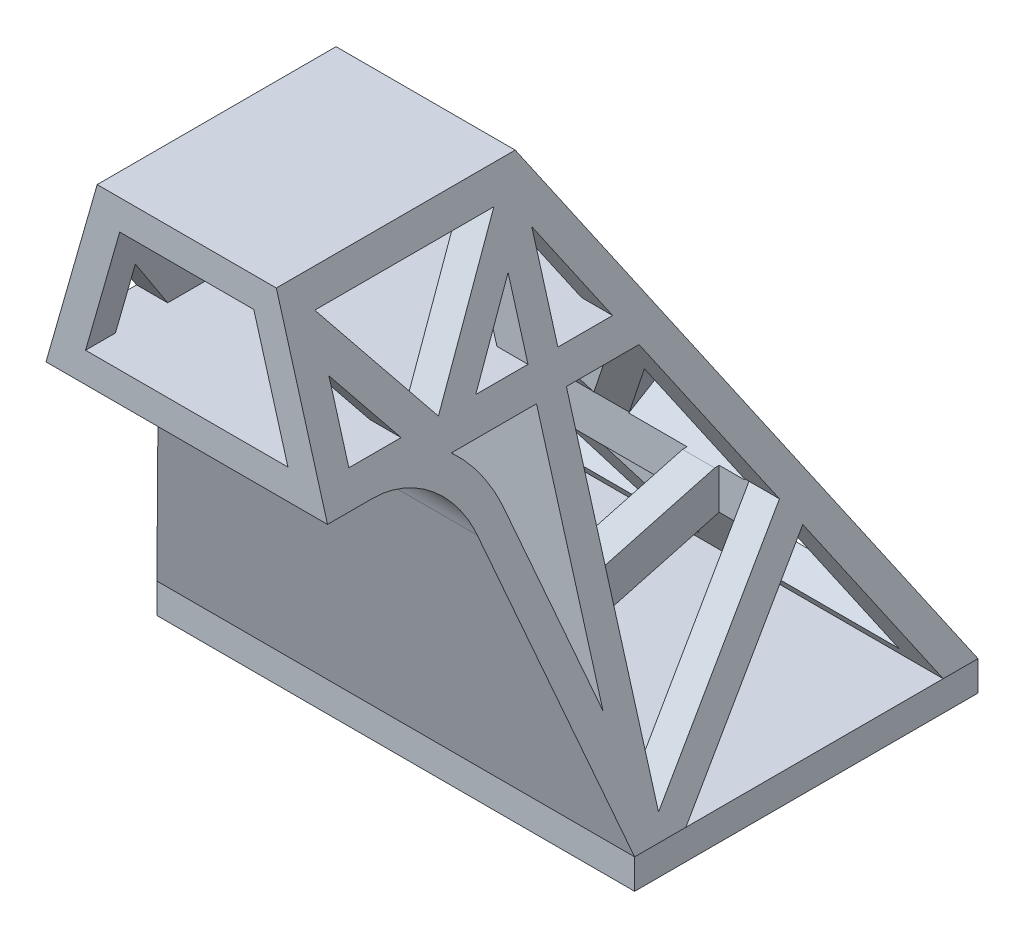
from build123d import *

# Parameters (mm, degrees)
SKETCH2_W               = 50.8
SKETCH2_H               = 58.7375
BOSS_EXTRUDE1_DEPTH     = 58.7375
CUT_EXTRUDE1_DEPTH      = 71.411486157
CUT_EXTRUDE1_DEPTH_BACK = 71.411486157
CUT_EXTRUDE2_DEPTH      = 71.411486157
CUT_EXTRUDE2_DEPTH_BACK = 71.411486157
CUT_EXTRUDE3_DEPTH      = 71.411486157
CUT_EXTRUDE3_DEPTH_BACK = 71.411486157
CUT_EXTRUDE4_DEPTH      = 87.863961529
CUT_EXTRUDE5_REACH      = 75.531
CUT_EXTRUDE7_REACH      = 98.825


with BuildPart() as part:
    # Sketch2 → Boss-Extrude1 (new body)
    with BuildSketch(Plane(origin=(0, 0, 0), x_dir=(1, 0, 0), z_dir=(0, 1, 0))):
        Rectangle(SKETCH2_W, SKETCH2_H)
    extrude(amount=BOSS_EXTRUDE1_DEPTH)

    # Sketch3 → Cut-Extrude1 (cut, two sides: drawn at the far end of the back side and taken through both)
    with BuildSketch(Plane.XY.offset(-CUT_EXTRUDE1_DEPTH_BACK)):
        Polygon((-25.4, 3.175), (-9.525, 58.7375), (-25.4, 58.7375), align=None)
        Polygon((9.525, 58.7375), (25.4, 3.175), (25.4, 58.7375), align=None)
    extrude(amount=CUT_EXTRUDE1_DEPTH + CUT_EXTRUDE1_DEPTH_BACK, mode=Mode.SUBTRACT)

    # Sketch4 → Cut-Extrude2 (cut, two sides: drawn at the far end of the back side and taken through both)
    with BuildSketch(Plane(origin=(0, 0, 0), x_dir=(0, 0, -1), z_dir=(1, 0, 0)).offset(-CUT_EXTRUDE2_DEPTH_BACK)):
        with BuildLine():
            Line((-29.36875, 39.6875), (-24.60625, 39.6875))
            ThreePointArc((-24.60625, 39.6875), (-18.851986567, 37.752893755), (-15.435200085, 32.734944063))
            Line((-15.435200085, 32.734944063), (-7.14375, 3.175))
            Line((-7.14375, 3.175), (-7.14375, 0))
            Line((-7.14375, 0), (-29.36875, 0))
            Line((-29.36875, 0), (-29.36875, 39.6875))
        make_face()
        Polygon((-3.96875, 58.7375), (29.36875, 3.175), (29.36875, 58.7375), align=None)
    extrude(amount=CUT_EXTRUDE2_DEPTH + CUT_EXTRUDE2_DEPTH_BACK, mode=Mode.SUBTRACT)

    # Sketch5 → Cut-Extrude3 (cut, two sides: drawn at the far end of the back side and taken through both)
    with BuildSketch(Plane(origin=(0, 0, 0), x_dir=(0, 0, -1), z_dir=(1, 0, 0)).offset(-CUT_EXTRUDE3_DEPTH_BACK)):
        with BuildLine():
            Line((-7.14375, 14.931086532), (-12.378183447, 33.592425417))
            ThreePointArc((-12.378183447, 33.592425417), (-13.851276644, 36.916798491), (-16.205989587, 39.6875))
            Line((-16.205989587, 39.6875), (-7.14375, 39.6875))
            Line((-7.14375, 39.6875), (-7.14375, 14.931086532))
        make_face()
        Polygon((-26.19375, 55.5625), (-16.66875, 42.8625), (-7.14375, 55.5625), align=None)
        Polygon((-26.19375, 50.270833333), (-26.19375, 42.8625), (-20.6375, 42.8625), align=None)
        Polygon((-7.14375, 50.270833333), (-7.14375, 42.8625), (-12.7, 42.8625), align=None)
        Polygon((-3.96875, 52.566409245), (1.853595547, 42.8625), (-3.96875, 42.8625), align=None)
        Polygon((13.872804904, 22.830484404), (3.758595547, 39.6875), (-3.96875, 39.6875), (-3.96875, 5.39468221), align=None)
        Polygon((15.551886189, 20.032015596), (25.666095547, 3.175), (-1.697413036, 3.175), align=None)
    extrude(amount=CUT_EXTRUDE3_DEPTH + CUT_EXTRUDE3_DEPTH_BACK, mode=Mode.SUBTRACT)

    # Sketch6 → Cut-Extrude4 (cut, through all)
    with BuildSketch(Plane.XY.offset(29.36875)):
        Polygon((-7.130093015, 55.5625), (-10.758664443, 42.8625), (10.758664443, 42.8625), (7.130093015, 55.5625), align=None)
    extrude(amount=-CUT_EXTRUDE4_DEPTH, mode=Mode.SUBTRACT)

    # Sketch7 → Cut-Extrude5 (cut, up to next)
    with BuildSketch(Plane(origin=(0, 13.797242647, -22.995404412), x_dir=(-1, 0, 0), z_dir=(0, 0.5144957554275265, -0.8574929257125442)), mode=Mode.PRIVATE) as cut_extrude5_sk1:
        Polygon((0, 12.341533155), (11.569683278, 30.720623487), (-11.569683278, 30.720623487), align=None)
    cut_extrude5_tool1 = extrude(cut_extrude5_sk1.sketch, amount=-CUT_EXTRUDE5_REACH, mode=Mode.PRIVATE) & part.part
    # Sketch7 → Cut-Extrude5 (cut, up to next)
    with BuildSketch(Plane(origin=(0, 13.797242647, -22.995404412), x_dir=(-1, 0, 0), z_dir=(0, 0.5144957554275265, -0.8574929257125442)), mode=Mode.PRIVATE) as cut_extrude5_sk2:
        Polygon((16.072523261, 12.341533155), (12.620752725, 26.430508719), (3.751707411, 12.341533155), align=None)
    cut_extrude5_tool2 = extrude(cut_extrude5_sk2.sketch, amount=-CUT_EXTRUDE5_REACH, mode=Mode.PRIVATE) & part.part
    # Sketch7 → Cut-Extrude5 (cut, up to next)
    with BuildSketch(Plane(origin=(0, 13.797242647, -22.995404412), x_dir=(-1, 0, 0), z_dir=(0, 0.5144957554275265, -0.8574929257125442)), mode=Mode.PRIVATE) as cut_extrude5_sk3:
        Polygon((-16.072523261, 12.341533155), (-12.620752725, 26.430508719), (-3.751707411, 12.341533155), align=None)
    cut_extrude5_tool3 = extrude(cut_extrude5_sk3.sketch, amount=-CUT_EXTRUDE5_REACH, mode=Mode.PRIVATE) & part.part
    # Sketch7 → Cut-Extrude5 (cut, up to next)
    with BuildSketch(Plane(origin=(0, 13.797242647, -22.995404412), x_dir=(-1, 0, 0), z_dir=(0, 0.5144957554275265, -0.8574929257125442)), mode=Mode.PRIVATE) as cut_extrude5_sk4:
        Polygon((0, -9.212557178), (11.569683278, 9.166533155), (-11.569683278, 9.166533155), align=None)
    cut_extrude5_tool4 = extrude(cut_extrude5_sk4.sketch, amount=-CUT_EXTRUDE5_REACH, mode=Mode.PRIVATE) & part.part
    # Sketch7 → Cut-Extrude5 (cut, up to next)
    with BuildSketch(Plane(origin=(0, 13.797242647, -22.995404412), x_dir=(-1, 0, 0), z_dir=(0, 0.5144957554275265, -0.8574929257125442)), mode=Mode.PRIVATE) as cut_extrude5_sk5:
        Polygon((-15.321390688, 9.166533155), (-3.751707411, -9.212557178), (-21.353231827, -9.212557178), (-16.850391844, 9.166533155), align=None)
    cut_extrude5_tool5 = extrude(cut_extrude5_sk5.sketch, amount=-CUT_EXTRUDE5_REACH, mode=Mode.PRIVATE) & part.part
    # Sketch7 → Cut-Extrude5 (cut, up to next)
    with BuildSketch(Plane(origin=(0, 13.797242647, -22.995404412), x_dir=(-1, 0, 0), z_dir=(0, 0.5144957554275265, -0.8574929257125442)), mode=Mode.PRIVATE) as cut_extrude5_sk6:
        Polygon((15.321390688, 9.166533155), (3.751707411, -9.212557178), (21.353231827, -9.212557178), (16.850391844, 9.166533155), align=None)
    cut_extrude5_tool6 = extrude(cut_extrude5_sk6.sketch, amount=-CUT_EXTRUDE5_REACH, mode=Mode.PRIVATE) & part.part
    add(cut_extrude5_tool1.solids().sort_by_distance((0, 34.886647, -10.341762))[0], mode=Mode.SUBTRACT)
    add(cut_extrude5_tool2.solids().sort_by_distance((-10.814994, 28.407086, -14.229499))[0], mode=Mode.SUBTRACT)
    add(cut_extrude5_tool3.solids().sort_by_distance((10.814994, 28.407086, -14.229499))[0], mode=Mode.SUBTRACT)
    add(cut_extrude5_tool4.solids().sort_by_distance((0, 16.404167, -21.43125))[0], mode=Mode.SUBTRACT)
    add(cut_extrude5_tool5.solids().sort_by_distance((13.824413, 11.570723, -24.331316))[0], mode=Mode.SUBTRACT)
    add(cut_extrude5_tool6.solids().sort_by_distance((-13.824413, 11.570723, -24.331316))[0], mode=Mode.SUBTRACT)

    # Cut-Extrude7: up to this plane
    cut_extrude7_end = Plane(origin=(-25.4, 3.175, 1.697413036), z_dir=(0, -1, 0))
    # Sketch9 → Cut-Extrude7 (cut, up to the surface)
    with BuildSketch(Plane(origin=(0, 4.743231432, 4.635360845), x_dir=(1, 0, 0), z_dir=(0, 0.7151924687815715, 0.6989275589058718)), mode=Mode.PRIVATE) as cut_extrude7_sk1:
        Polygon((0, 0.932071958), (9.953085751, 25.878580322), (-9.953085751, 25.878580322), align=None)
    cut_extrude7_tool1 = split(extrude(cut_extrude7_sk1.sketch, amount=CUT_EXTRUDE7_REACH, dir=(0, -1, 0), mode=Mode.PRIVATE), bisect_by=cut_extrude7_end, keep=Keep.BOTH, mode=Mode.PRIVATE)
    add(cut_extrude7_tool1.solids().sort_by_distance((0, 17.01855, -7.92562))[0], mode=Mode.SUBTRACT)
    # Sketch9 → Cut-Extrude7 (cut, up to the surface)
    with BuildSketch(Plane(origin=(0, 4.743231432, 4.635360845), x_dir=(1, 0, 0), z_dir=(0, 0.7151924687815715, 0.6989275589058718)), mode=Mode.PRIVATE) as cut_extrude7_sk2:
        Polygon((21.528118344, 0.932071958), (16.546460574, 25.878580322), (13.371460574, 25.878580322), (3.418374823, 0.932071958), align=None)
    cut_extrude7_tool2 = split(extrude(cut_extrude7_sk2.sketch, amount=CUT_EXTRUDE7_REACH, dir=(0, -1, 0), mode=Mode.PRIVATE), bisect_by=cut_extrude7_end, keep=Keep.BOTH, mode=Mode.PRIVATE)
    add(cut_extrude7_tool2.solids().sort_by_distance((13.425414, 12.07357, -2.865564))[0], mode=Mode.SUBTRACT)
    # Sketch9 → Cut-Extrude7 (cut, up to the surface)
    with BuildSketch(Plane(origin=(0, 4.743231432, 4.635360845), x_dir=(1, 0, 0), z_dir=(0, 0.7151924687815715, 0.6989275589058718)), mode=Mode.PRIVATE) as cut_extrude7_sk3:
        Polygon((-21.528118344, 0.932071958), (-16.546460574, 25.878580322), (-13.371460574, 25.878580322), (-3.418374823, 0.932071958), align=None)
    cut_extrude7_tool3 = split(extrude(cut_extrude7_sk3.sketch, amount=CUT_EXTRUDE7_REACH, dir=(0, -1, 0), mode=Mode.PRIVATE), bisect_by=cut_extrude7_end, keep=Keep.BOTH, mode=Mode.PRIVATE)
    add(cut_extrude7_tool3.solids().sort_by_distance((-13.425414, 12.07357, -2.865564))[0], mode=Mode.SUBTRACT)


solid = part.part
